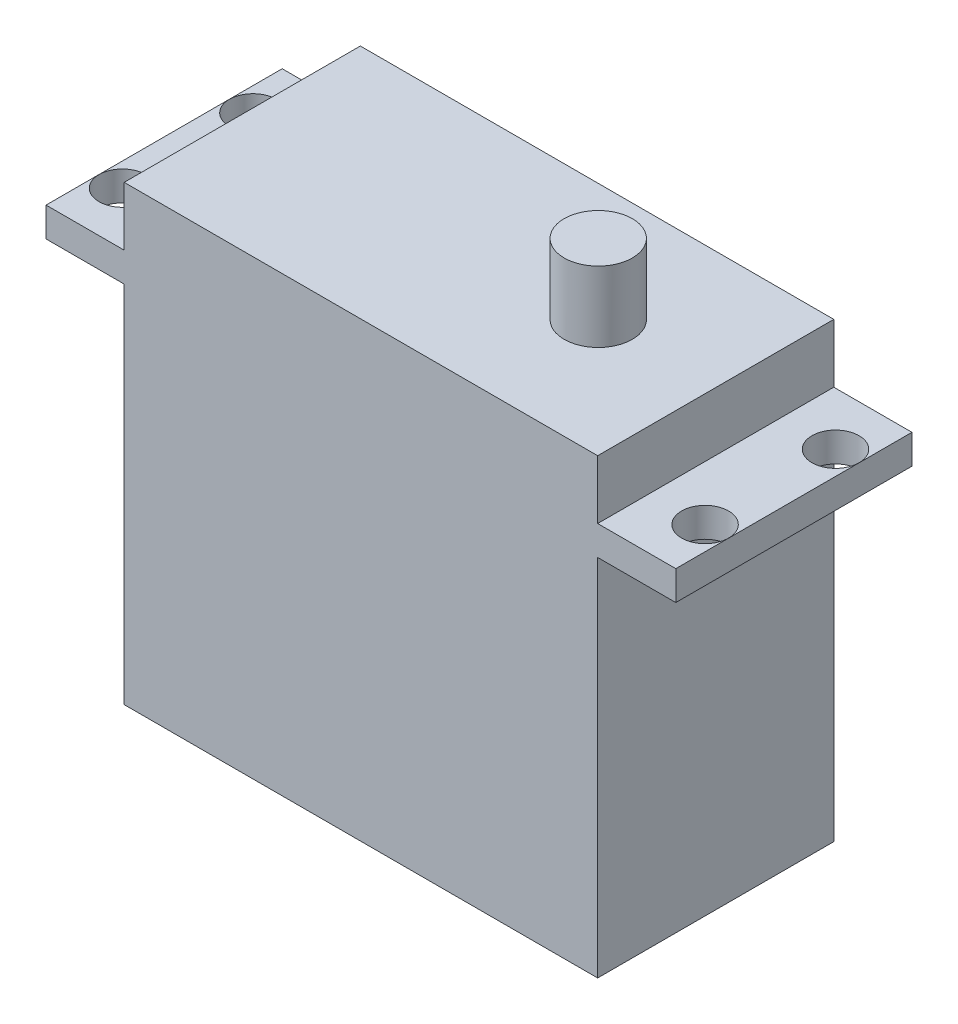
from build123d import *

# Parameters (mm, degrees)
SKETCH1_W           = 40.3
SKETCH1_H           = 20.1
BOSS_EXTRUDE1_DEPTH = 38.5
SKETCH2_R           = 2.9
BOSS_EXTRUDE2_DEPTH = 6
BOSS_EXTRUDE3_START = -5
SKETCH3_W           = 6.65
SKETCH3_H           = 20.1
SKETCH3_R           = 2
BOSS_EXTRUDE3_DEPTH = 2.5


with BuildPart() as part:
    # Sketch1 → Boss-Extrude1 (new body)
    with BuildSketch(Plane(origin=(0, 0, 0), x_dir=(1, 0, 0), z_dir=(0, 1, 0))):
        Rectangle(SKETCH1_W, SKETCH1_H)
    extrude(amount=BOSS_EXTRUDE1_DEPTH)

    # Sketch2 → Boss-Extrude2 (add)
    with BuildSketch(Plane(origin=(0, 38.5, 0), x_dir=(1, 0, 0), z_dir=(0, 1, 0))):
        with Locations((10.15, 0)):
            Circle(SKETCH2_R)
    extrude(amount=BOSS_EXTRUDE2_DEPTH)

    # Sketch3 → Boss-Extrude3 (add)
    # profile 1 of 2: a face of its own
    with BuildSketch(Plane(origin=(0, 38.5, 0), x_dir=(1, 0, 0), z_dir=(0, 1, 0)).offset(BOSS_EXTRUDE3_START)):
        with Locations((-23.475, 0)):
            Rectangle(SKETCH3_W, SKETCH3_H)
        with Locations((-24.794421729, -5.55)):
            Circle(SKETCH3_R, mode=Mode.SUBTRACT)
        with Locations((-24.794421729, 5.55)):
            Circle(SKETCH3_R, mode=Mode.SUBTRACT)
    # profile 2 of 2: a face of its own
    with BuildSketch(Plane(origin=(0, 38.5, 0), x_dir=(1, 0, 0), z_dir=(0, 1, 0)).offset(BOSS_EXTRUDE3_START)):
        with Locations((23.475, 0)):
            Rectangle(SKETCH3_W, SKETCH3_H)
        with Locations((24.794421729, -5.55)):
            Circle(SKETCH3_R, mode=Mode.SUBTRACT)
        with Locations((24.794421729, 5.55)):
            Circle(SKETCH3_R, mode=Mode.SUBTRACT)
    extrude(amount=-BOSS_EXTRUDE3_DEPTH)


solid = part.part
